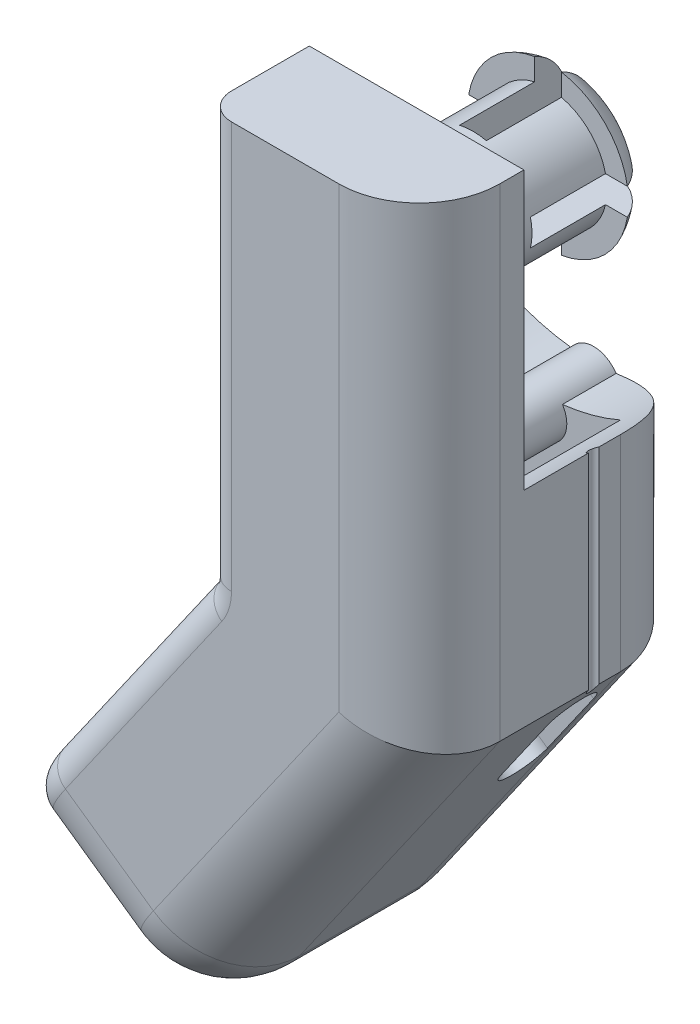
from build123d import *

# Parameters (mm, degrees)
BOSS_EXTRUDE1_DEPTH      = 5.715
BOSS_EXTRUDE1_DEPTH_BACK = 4.445
SKETCH2_R                = 2.7940000000000054
SKETCH3_W                = 1.269999999999993
SKETCH3_H                = 1.2700000000000102
CUT_EXTRUDE1_DEPTH       = 5.08
BOSS_EXTRUDE2_DEPTH      = 1.524
FILLET1_R                = 2.54
BOSS_EXTRUDE3_DEPTH      = 2.54
BOSS_EXTRUDE3_DEPTH_BACK = 2.413
SKETCH5_R                = 2.7940000000000054
BOSS_EXTRUDE4_DEPTH      = 8.382
CUT_EXTRUDE2_START       = -1.7145
CUT_EXTRUDE2_DEPTH       = 5.8420000000000005
CUT_EXTRUDE5_DEPTH       = 1.27
BOSS_EXTRUDE5_REACH      = 131.655
SKETCH11_R               = 1.2700000000000067
CUT_EXTRUDE6_DEPTH       = 31.835580227886044
CUT_EXTRUDE6_DEPTH_BACK  = 31.835580227886044
SKETCH12_R               = 0.25399999999999967
FILLET2_R                = 3.8099999999999996
FILLET3_R                = 3.8099999999999996
FILLET4_R                = 1.27


with BuildPart() as part:
    # Sketch2 → Boss-Extrude1 (new, two sides: drawn at the far end of the back side and taken through both)
    with BuildSketch(Plane.XY.offset(-BOSS_EXTRUDE1_DEPTH_BACK)):
        with Locations((-4.07886393202022, -93.55895801032833)):
            Circle(SKETCH2_R)
    extrude(amount=BOSS_EXTRUDE1_DEPTH + BOSS_EXTRUDE1_DEPTH_BACK)

    # Sketch3 → Cut-Extrude1 (cut)
    with BuildSketch(Plane(origin=(0, 0, -4.445), x_dir=(-1, 0, 0), z_dir=(0, 0, -1))):
        with BuildLine():
            Line((3.443863932020214, -94.1939580103283), (3.443863932020214, -92.9239580103283))
            Line((3.4438639320202142, -92.9239580103283), (1.357979700745413, -92.9239580103283))
            ThreePointArc((1.3579797007454042, -92.92395801032826), (1.3032030609678973, -93.23936024921431), (1.2848639320202149, -93.55895801032833))
            ThreePointArc((1.2848639320202149, -93.55895801032833), (1.3032030609678946, -93.87855577144232), (1.3579797007453935, -94.19395801032834))
            Line((1.357979700745402, -94.1939580103283), (3.4438639320202142, -94.1939580103283))
        make_face()
        with Locations((4.0788639320202105, -93.5589580103283)):
            Rectangle(SKETCH3_W, SKETCH3_H)
        with BuildLine():
            ThreePointArc((4.713863932020238, -90.8380737790535), (4.398461693134176, -90.783297139276), (4.078863932020155, -90.76495801032831))
            ThreePointArc((4.078863932020155, -90.76495801032831), (3.7592661709062294, -90.783297139276), (3.4438639320202613, -90.83807377905349))
            Line((3.4438639320202147, -90.83807377905347), (3.443863932020214, -92.9239580103283))
            Line((3.4438639320202142, -92.9239580103283), (4.713863932020207, -92.9239580103283))
            Line((4.713863932020207, -92.9239580103283), (4.713863932020208, -90.8380737790535))
        make_face()
        with BuildLine():
            Line((6.7997481632950585, -92.9239580103283), (4.713863932020207, -92.9239580103283))
            Line((4.713863932020207, -92.9239580103283), (4.713863932020207, -94.1939580103283))
            Line((4.713863932020207, -94.1939580103283), (6.7997481632950665, -94.1939580103283))
            ThreePointArc((6.79974816329506, -94.19395801032829), (6.854524803072549, -93.87855577144228), (6.872863932020225, -93.55895801032833))
            ThreePointArc((6.872863932020225, -93.55895801032833), (6.854524803072548, -93.23936024921436), (6.799748163295054, -92.92395801032833))
        make_face()
        with BuildLine():
            Line((4.713863932020207, -94.1939580103283), (3.4438639320202142, -94.1939580103283))
            Line((3.443863932020214, -94.1939580103283), (3.443863932020213, -96.27984224160318))
            ThreePointArc((3.4438639320202564, -96.27984224160316), (3.759266170906339, -96.33461888138066), (4.078863932020378, -96.35295801032834))
            ThreePointArc((4.078863932020378, -96.35295801032834), (4.398461693134285, -96.33461888138064), (4.713863932020234, -96.27984224160315))
            Line((4.713863932020206, -96.27984224160315), (4.713863932020207, -94.1939580103283))
        make_face()
    extrude(amount=-CUT_EXTRUDE1_DEPTH, mode=Mode.SUBTRACT)

    # Sketch4 → Boss-Extrude2 (add)
    with BuildSketch(Plane(origin=(0, 0, -4.445), x_dir=(-1, 0, 0), z_dir=(0, 0, -1))):
        with BuildLine():
            Line((0.3221532697519658, -92.9239580103283), (1.3579797007453926, -92.9239580103283))
            ThreePointArc((1.3579797007453926, -92.9239580103283), (2.1032075853849994, -91.58330166369309), (3.443863932020213, -90.83807377905349))
            Line((3.4438639320202116, -90.83807377905349), (3.443863932020211, -89.80224734806006))
            ThreePointArc((3.443863932020212, -89.80224734806006), (1.3847870956994783, -90.86488117400758), (0.32215326975196623, -92.9239580103283))
        make_face()
        with BuildLine():
            Line((3.4438639320202147, -97.31566867259657), (3.4438639320202142, -96.27984224160315))
            ThreePointArc((3.443863932020213, -96.27984224160315), (2.1032075853849905, -95.53461435696353), (1.3579797007453847, -94.1939580103283))
            Line((1.3579797007453842, -94.1939580103283), (0.32215326975196246, -94.1939580103283))
            ThreePointArc((0.3221532697519591, -94.1939580103283), (1.384787095699461, -96.25303484664906), (3.443863932020211, -97.31566867259659))
        make_face()
        with BuildLine():
            Line((4.713863932020205, -96.27984224160316), (4.713863932020205, -97.31566867259659))
            ThreePointArc((4.713863932020205, -97.31566867259659), (6.772940768340969, -96.25303484664907), (7.835574594288481, -94.1939580103283))
            Line((7.835574594288476, -94.1939580103283), (6.799748163295055, -94.1939580103283))
            ThreePointArc((6.799748163295052, -94.1939580103283), (6.054520278655444, -95.53461435696354), (4.713863932020207, -96.27984224160316))
        make_face()
        with BuildLine():
            Line((4.713863932020206, -89.80224734806005), (4.713863932020206, -90.83807377905347))
            ThreePointArc((4.713863932020206, -90.83807377905347), (6.054520278655427, -91.58330166369309), (6.799748163295051, -92.9239580103283))
            Line((6.799748163295051, -92.9239580103283), (7.835574594288472, -92.9239580103283))
            ThreePointArc((7.835574594288474, -92.9239580103283), (6.772940768340954, -90.86488117400756), (4.713863932020203, -89.80224734806006))
        make_face()
    extrude(amount=-BOSS_EXTRUDE2_DEPTH)

    # Fillet1
    # the kernel refuses this fillet: 2.54 mm, written as the material it takes off along each edge
    with BuildSketch(Plane(origin=(-4.0788639320202495, -93.55895801032834, -4.445), x_dir=(-0.9779601169479317, 0.2087917854207577, 0), z_dir=(-0.2087917854207577, -0.9779601169479317, 0))) as fillet1_piece_1:
        with BuildLine():
            CenterArc((1.4820515469624638, -2.54), FILLET1_R, 23.578178478201842, 66.42182152179817)
            Line((1.4820515469624638, 0), (1.4820515469624638, 0.05079999999999973))
            Line((1.4820515469624638, 0.05079999999999973), (3.8100000000000294, 0.05079999999999973))
            Line((3.8100000000000294, 0.05079999999999973), (3.8608000000000278, 0))
            ThreePointArc((3.8608000000000278, 0), (3.860800000000029, -0.762), (3.8565589690607793, -1.5036800000000001))
            Line((3.8565589690607793, -1.5036800000000001), (3.81000000000003, -1.524))
        make_face()
    revolve(axis=Axis((-4.0788639320202495, -93.55895801032834, -4.445), (0, 0, -1)), revolution_arc=245.89688563167445, mode=Mode.SUBTRACT)
    with BuildSketch(Plane(origin=(-4.078863932020237, -93.55895801032833, -4.445), x_dir=(0.20879178542072774, 0.9779601169479382, 0), z_dir=(-0.9779601169479382, 0.20879178542072774, 0))) as fillet1_piece_2:
        with BuildLine():
            CenterArc((1.4820515469624473, -2.54), FILLET1_R, 23.578178478201917, 66.42182152179808)
            Line((1.4820515469624473, 0), (1.4820515469624473, 0.05079999999999973))
            Line((1.4820515469624473, 0.05079999999999973), (3.8100000000000094, 0.05079999999999973))
            Line((3.8100000000000094, 0.05079999999999973), (3.8608000000000127, 0))
            ThreePointArc((3.8608000000000127, 0), (3.8608000000000127, -0.7619999999999991), (3.8565589690607562, -1.5036799999999984))
            Line((3.8565589690607562, -1.5036799999999984), (3.810000000000009, -1.5239999999999982))
        make_face()
    revolve(axis=Axis((-4.078863932020237, -93.55895801032833, -4.445), (0, 0, -1)), revolution_arc=245.89688563167698, mode=Mode.SUBTRACT)
    with BuildSketch(Plane(origin=(-4.078863932020216, -93.55895801032833, -4.445), x_dir=(0.9779601169479387, -0.2087917854207255, 0), z_dir=(0.2087917854207255, 0.9779601169479387, 0))) as fillet1_piece_3:
        with BuildLine():
            CenterArc((1.482051546962437, -2.5400000000000005), FILLET1_R, 23.578178478201817, 66.42182152179818)
            Line((1.482051546962437, 0), (1.482051546962437, 0.05079999999999975))
            Line((1.482051546962437, 0.05079999999999975), (3.8100000000000045, 0.05079999999999975))
            Line((3.8100000000000045, 0.05079999999999975), (3.860800000000004, 0))
            ThreePointArc((3.860800000000004, 0), (3.860800000000005, -0.7620000000000007), (3.856558969060754, -1.503680000000001))
            Line((3.856558969060754, -1.503680000000001), (3.810000000000004, -1.524000000000001))
        make_face()
    revolve(axis=Axis((-4.078863932020216, -93.55895801032833, -4.445), (0, 0, -1)), revolution_arc=245.89688563167826, mode=Mode.SUBTRACT)
    with BuildSketch(Plane(origin=(-4.078863932020221, -93.55895801032833, -4.445), x_dir=(-0.20879178542073795, -0.9779601169479358, 0), z_dir=(0.9779601169479358, -0.20879178542073795, 0))) as fillet1_piece_4:
        with BuildLine():
            CenterArc((1.482051546962436, -2.5399999999999996), FILLET1_R, 23.57817847820183, 66.42182152179817)
            Line((1.482051546962436, 0), (1.482051546962436, 0.05079999999999972))
            Line((1.482051546962436, 0.05079999999999972), (3.8100000000000027, 0.05079999999999972))
            Line((3.8100000000000027, 0.05079999999999972), (3.8608000000000064, 0))
            ThreePointArc((3.8608000000000064, 0), (3.8608000000000064, -0.7619999999999998), (3.85655896906075, -1.5036799999999997))
            Line((3.85655896906075, -1.5036799999999997), (3.8100000000000027, -1.5239999999999996))
        make_face()
    revolve(axis=Axis((-4.078863932020221, -93.55895801032833, -4.445), (0, 0, -1)), revolution_arc=245.8968856316771, mode=Mode.SUBTRACT)

    # Sketch5 → Boss-Extrude3 (add, two sides: drawn at the far end of the back side and taken through both)
    # profile 1 of 4: a face of its own
    with BuildSketch(Plane.XY.offset(5.714999999999999).offset(-BOSS_EXTRUDE3_DEPTH_BACK)):
        Polygon((-7.321448701996413, -105.51142141700173), (1.001136067979783, -111.33895801032831), (1.0011360679797812, -88.47895801032831), (-9.158863932020221, -88.47895801032831), (-9.158863932020218, -108.13552231531784), align=None)
        with Locations((-4.07886393202022, -93.55895801032833)):
            Circle(SKETCH5_R, mode=Mode.SUBTRACT)
    # profile 2 of 4: a face of its own
    with BuildSketch(Plane.XY.offset(5.714999999999999).offset(-BOSS_EXTRUDE3_DEPTH_BACK)):
        Polygon((-9.158863932020218, -111.33895801032831), (1.0011360679797825, -111.33895801032831), (-7.321448701996413, -105.51142141700173), (-9.158863932020203, -108.13552231531784), align=None)
    # profile 3 of 4: a face of its own
    with BuildSketch(Plane.XY.offset(5.714999999999999).offset(-BOSS_EXTRUDE3_DEPTH_BACK)):
        Polygon((-18.976521888649557, -122.1565909569541), (-10.653937118673376, -127.98412755028069), (1.0011360679797825, -111.33895801032831), (-9.158863932020218, -111.33895801032831), (-9.158863932020218, -108.13552231531784), align=None)
    # profile 4 of 4: a face of its own
    with BuildSketch(Plane.XY.offset(5.714999999999999).offset(-BOSS_EXTRUDE3_DEPTH_BACK)):
        with Locations((-4.07886393202022, -93.55895801032833)):
            Circle(SKETCH5_R)
    extrude(amount=BOSS_EXTRUDE3_DEPTH + BOSS_EXTRUDE3_DEPTH_BACK)

    # Sketch6 → Boss-Extrude4 (add)
    with BuildSketch(Plane(origin=(0, 0, 3.3019999999999996), x_dir=(-1, 0, 0), z_dir=(0, 0, -1))):
        with BuildLine():
            ThreePointArc((9.158863932020274, -101.61620474851374), (4.078863932020362, -103.08395801032833), (-1.0011360679795924, -101.6162047485139))
            Line((-1.0011360679797892, -101.61620474851397), (-1.0011360679797952, -111.33895801032828))
            Line((-1.0011360679797952, -111.33895801032828), (10.65393711867338, -127.98412755028066))
            Line((10.65393711867338, -127.98412755028066), (18.97652188864956, -122.1565909569541))
            Line((18.97652188864956, -122.1565909569541), (9.15886393202022, -108.13552231531789))
            Line((9.15886393202022, -108.13552231531789), (9.15886393202022, -101.61620474851372))
        make_face()
    extrude(amount=BOSS_EXTRUDE4_DEPTH)

    # Sketch9 → Cut-Extrude2 (cut)
    with BuildSketch(Plane(origin=(0, 0, 1.5874999999999995), x_dir=(-1, 0, 0), z_dir=(0, 0, -1)).offset(CUT_EXTRUDE2_START)):
        with BuildLine():
            ThreePointArc((7.8888639320202145, -102.2887647092192), (4.078863932020218, -103.08395801032832), (0.26886393202022063, -102.2887647092192))
            Line((0.2688639320202225, -102.2887647092192), (0.26886393202022346, -110.93852854845198))
            Line((0.2688639320202233, -110.93852854845198), (3.9794333963345303, -116.23777093279071))
            Line((3.9794333963345303, -116.23777093279071), (7.888863932020215, -107.85397009376136))
            Line((7.888863932020215, -107.85397009376136), (7.888863932020214, -102.2887647092192))
        make_face()
    extrude(amount=CUT_EXTRUDE2_DEPTH, mode=Mode.SUBTRACT)

    # Sketch10 → Cut-Extrude5 (cut)
    with BuildSketch(Plane(origin=(52.983971008867975, -37.099775904693615, 0), x_dir=(0, 0, -1), z_dir=(0.8191520442889951, -0.5735764363510415, 0))):
        with BuildLine():
            Line((1.0896366691639499, -92.53430700499268), (1.089636669163951, -96.34430700499269))
            ThreePointArc((1.089636669163951, -96.34430700499269), (3e-17, -97.43394367415664), (-1.0896366691639492, -96.34430700499269))
            Line((-1.0896366691639492, -96.34430700499269), (-1.0896366691639503, -92.53430700499268))
            ThreePointArc((-1.0896366691639503, -92.53430700499268), (-8.7e-16, -91.44467033582873), (1.0896366691639499, -92.53430700499268))
        make_face()
    extrude(amount=-CUT_EXTRUDE5_DEPTH, mode=Mode.SUBTRACT)

    # Boss-Extrude5: up to this face of the body (flat: up to its plane)
    boss_extrude5_end = Plane(part.part.faces().sort_by_distance((-7.766430245, -114.366891782, -5.08))[0])
    # Sketch11 → Boss-Extrude5 (add, up to the picked face)
    with BuildSketch(Plane(origin=(0, 0, 3.3019999999999996), x_dir=(-1, 0, 0), z_dir=(0, 0, -1)), mode=Mode.PRIVATE) as boss_extrude5_sk1:
        with Locations(Location((4.07886393202022, -103.71895801032832, 0), (0, 0, 180))):
            Circle(SKETCH11_R)
    boss_extrude5_tool1 = split(extrude(boss_extrude5_sk1.sketch, amount=BOSS_EXTRUDE5_REACH, mode=Mode.PRIVATE), bisect_by=boss_extrude5_end, keep=Keep.BOTH, mode=Mode.PRIVATE)
    add(boss_extrude5_tool1.solids().sort_by(Axis((-4.078864, -103.718958, 3.302), (0, 0, -1)))[0])

    # Sketch12 → Cut-Extrude6 (cut, two sides: drawn at the far end of the back side and taken through both)
    with BuildSketch(Plane(origin=(8.45e-15, -111.33895801032828, -1.1587e-13), x_dir=(-3.9e-16, 1.04e-15, -1), z_dir=(8e-17, -1, -1.04e-15)).offset(-CUT_EXTRUDE6_DEPTH_BACK)):
        with Locations((-1.1536e-13, 1.0011360679797674)):
            Circle(SKETCH12_R)
    extrude(amount=CUT_EXTRUDE6_DEPTH + CUT_EXTRUDE6_DEPTH_BACK, mode=Mode.SUBTRACT)

    # Fillet2
    fillet2_edges = [part.edges().sort_by_distance(p)[0] for p in [
        (1.001136067979782, -99.90895801032832, 8.254999999999999),
        (-4.826400525346797, -119.6615427803045, 8.254999999999999),
        (1.0011360679797923, -106.47758137942112, -5.08),
        (-4.826400525346792, -119.66154278030447, -5.08),
    ]]
    fillet(fillet2_edges, radius=FILLET2_R)

    # Fillet3
    fillet3_edges = [part.edges().sort_by_distance(p)[0] for p in [
        (-16.375714148032007, -123.97769614236866, -5.08),
        (-10.653937118673378, -127.98412755028068, 1.5874999999999995),
        (-16.375714148032, -123.97769614236866, 8.254999999999999),
        (-11.568047859470674, -127.34406031881595, 7.139076836320745),
        (-11.568047859470692, -127.34406031881595, -3.9640768363207504),
    ]]
    fillet(fillet3_edges, radius=FILLET3_R)

    # Fillet4
    fillet4_edges = [part.edges().sort_by_distance(p)[0] for p in [
        (-9.158863932020214, -108.13552231531787, 1.5874999999999995),
        (-9.15886393202022, -98.30724016282308, 8.254999999999999),
        (-9.15886393202022, -104.8758635319158, -5.08),
        (-12.975029799086151, -113.58557199176545, 8.254999999999999),
        (-18.97652188864956, -122.1565909569541, 1.5874999999999977),
        (-12.975029799086158, -113.58557199176546, -5.08),
        (-18.336454657184838, -121.2424802161568, -3.9640768363207477),
        (-18.336454657184838, -121.2424802161568, 7.139076836320744),
    ]]
    fillet(fillet4_edges, radius=FILLET4_R)


solid = part.part
